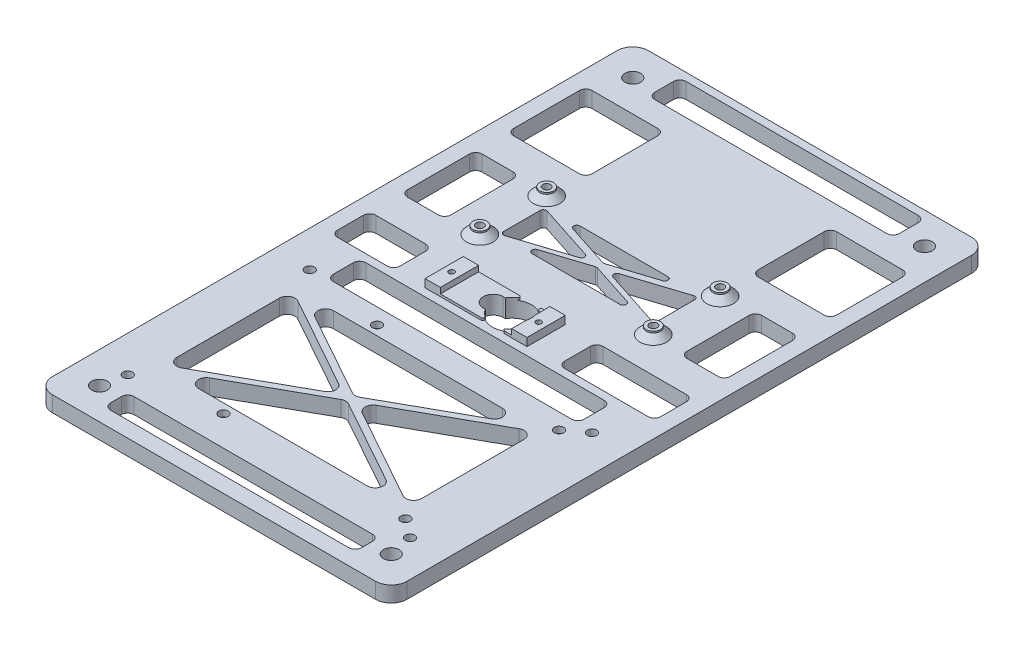
from build123d import *

# Parameters (mm, degrees)
SKETCH1_R           = 2.5000000000000027
BOSS_EXTRUDE1_DEPTH = 5
FILLET1_R           = 5
SKETCH2_R           = 1.5000000000000042
SKETCH2_R_2         = 1.5000000000000009
CUT_EXTRUDE1_DEPTH  = 10
SKETCH3_R           = 1.4999999999999967
SKETCH3_R_2         = 1.4999999999999973
CUT_EXTRUDE2_DEPTH  = 10
CUT_EXTRUDE4_DEPTH  = 10
BOSS_EXTRUDE2_DEPTH = 0.75
CUT_EXTRUDE10_REACH = 112.681
BOSS_EXTRUDE3_START = 2.55
SKETCH14_R          = 0.8750000000000001
SKETCH14_R_2        = 0.8750000000000018
BOSS_EXTRUDE3_DEPTH = 2.55
FILLET2_R           = 0.5
CUT_EXTRUDE9_DEPTH  = 111.64470163546024
CUT_EXTRUDE11_REACH = 112.645
SKETCH15_W          = 19.87499999999999
SKETCH15_H          = 12.200000000000001
SKETCH15_W_2        = 30.625000000000018
FILLET3_R           = 2
CUT_EXTRUDE12_REACH = 112.789
SKETCH16_R          = 1.2500000000000013
CUT_EXTRUDE13_REACH = 112.645
CUT_EXTRUDE14_DEPTH = 111.64470163546024
SKETCH19_R          = 2.2500000000000027
SKETCH19_R_2        = 1.2500000000000013
SKETCH19_R_3        = 2.2500000000000018
BOSS_EXTRUDE4_DEPTH = 2.5
CHAMFER1_SIZE       = 2
SKETCH20_R          = 2.499999999999999
SKETCH20_R_2        = 2.4999999999999982
SKETCH20_R_3        = 2.5000000000000027
CUT_EXTRUDE15_DEPTH = 3


with BuildPart() as part:
    # Sketch1 → Boss-Extrude1 (new body)
    with BuildSketch(Plane(origin=(0, 0, 0), x_dir=(1, 0, 0), z_dir=(0, 1, 0))):
        Polygon((-56.499999999999986, -94.99999999999974), (-56.499999999999986, 95.00000000000009), (56.500000000000014, 94.99999999999997), (56.500000000000014, -94.99999999999986), align=None)
        with Locations((46.500000000000014, 85.00000000000007)):
            Circle(SKETCH1_R, mode=Mode.SUBTRACT)
        with Locations((-46.499999999999986, 85.00000000000007)):
            Circle(SKETCH1_R, mode=Mode.SUBTRACT)
        with Locations((-46.499999999999986, -84.99999999999986)):
            Circle(SKETCH1_R, mode=Mode.SUBTRACT)
        with Locations((46.500000000000014, -84.99999999999986)):
            Circle(SKETCH1_R, mode=Mode.SUBTRACT)
    extrude(amount=BOSS_EXTRUDE1_DEPTH)

    # Fillet1
    fillet1_edges = [part.edges().sort_by_distance(p)[0] for p in [
        (-56.499999999999986, 2.5, 94.99999999999974),
        (-56.499999999999986, 2.5, -95.00000000000009),
        (56.500000000000014, 2.5, -94.99999999999997),
        (56.500000000000014, 2.5, 94.99999999999986),
    ]]
    fillet(fillet1_edges, radius=FILLET1_R)

    # Sketch2 → Cut-Extrude1 (cut)
    with BuildSketch(Plane(origin=(0, 5, 0), x_dir=(1, 0, 0), z_dir=(0, 1, 0))):
        with Locations((38.999999999999886, -23.999999999999687)):
            Circle(SKETCH2_R)
        with Locations((38.999999999999886, -72.99999999999973)):
            Circle(SKETCH2_R)
        with Locations((-19.000000000000114, -23.9999999999998)):
            Circle(SKETCH2_R_2)
        with Locations((-19.000000000000114, -72.99999999999973)):
            Circle(SKETCH2_R_2)
    extrude(amount=-CUT_EXTRUDE1_DEPTH, mode=Mode.SUBTRACT)

    # Sketch3 → Cut-Extrude2 (cut)
    with BuildSketch(Plane(origin=(0, 5, 0), x_dir=(1, 0, 0), z_dir=(0, 1, 0))):
        with Locations((45.00000000000002, -19.49999999999963)):
            Circle(SKETCH3_R)
        with Locations((45.00000000000002, -77.49999999999979)):
            Circle(SKETCH3_R_2)
        with Locations((-44.999999999999964, -19.49999999999963)):
            Circle(SKETCH3_R)
        with Locations((-44.999999999999964, -77.49999999999979)):
            Circle(SKETCH3_R_2)
    extrude(amount=-CUT_EXTRUDE2_DEPTH, mode=Mode.SUBTRACT)

    # Sketch5 → Cut-Extrude4 (cut)
    with BuildSketch(Plane(origin=(0, 5, 0), x_dir=(1, 0, 0), z_dir=(0, 1, 0))):
        with BuildLine():
            Line((-37.99999999999997, -89.99999999999986), (38.00000000000003, -89.99999999999986))
            ThreePointArc((38.00000000000003, -89.99999999999986), (39.41421356237312, -89.41421356237295), (40.00000000000003, -87.99999999999986))
            Line((40.00000000000003, -87.99999999999986), (40.00000000000003, -84.49999999999991))
            ThreePointArc((40.00000000000003, -84.49999999999991), (39.414213562373135, -83.08578643762681), (38.00000000000003, -82.4999999999999))
            Line((38.00000000000003, -82.4999999999999), (-37.99999999999997, -82.4999999999999))
            ThreePointArc((-37.99999999999997, -82.4999999999999), (-39.414213562373064, -83.08578643762682), (-39.99999999999997, -84.49999999999991))
            Line((-39.99999999999997, -84.49999999999991), (-39.99999999999997, -87.99999999999986))
            ThreePointArc((-39.99999999999997, -87.99999999999986), (-39.414213562373064, -89.41421356237295), (-37.99999999999997, -89.99999999999986))
        make_face()
    extrude(amount=-CUT_EXTRUDE4_DEPTH, mode=Mode.SUBTRACT)

    # Sketch6 → Boss-Extrude2 (add)
    with BuildSketch(Plane(origin=(0, 5, 0), x_dir=(1, 0, 0), z_dir=(0, 1, 0))):
        Polygon((6, -6.099999999999998), (-16.75, -6.1000000000000005), (-16.75, 6.1), (6, 6.100000000000001), align=None)
    extrude(amount=BOSS_EXTRUDE2_DEPTH)

    # Sketch13 → Cut-Extrude10 (cut, up to next)
    with BuildSketch(Plane(origin=(0, 5.75, 0), x_dir=(1, 0, 0), z_dir=(0, 1, 0)), mode=Mode.PRIVATE) as cut_extrude10_sk1:
        with BuildLine():
            Line((-5.975000000000009, 3.1750000000000003), (-5.325352101035195, 3.1750000000000087))
            ThreePointArc((-5.325352101035195, 3.1750000000000087), (6.200000000000003, -5.51e-15), (-5.325352101035201, -3.1750000000000003))
            Line((-5.325352101035201, -3.1750000000000003), (-5.974999999999967, -3.1750000000000003))
            ThreePointArc((-5.974999999999967, -3.1750000000000003), (-9.15, -2.076e-14), (-5.975000000000009, 3.1750000000000003))
        make_face()
    cut_extrude10_tool1 = extrude(cut_extrude10_sk1.sketch, amount=-CUT_EXTRUDE10_REACH, mode=Mode.PRIVATE) & part.part
    add(cut_extrude10_tool1.solids().sort_by_distance((-0.860955, 5.75, 0))[0], mode=Mode.SUBTRACT)

    # Sketch14 → Boss-Extrude3 (add)
    # profile 1 of 2: a face of its own
    with BuildSketch(Plane(origin=(0, 5, 0), x_dir=(1, 0, 0), z_dir=(0, 1, 0)).offset(BOSS_EXTRUDE3_START)):
        with BuildLine():
            Line((6, 6.100000000000001), (10.875000000000002, 6.100000000000001))
            Line((10.875000000000002, 6.100000000000001), (10.875000000000005, -6.100000000000001))
            Line((10.875000000000005, -6.100000000000001), (6.000000000000002, -6.100000000000001))
            Line((6.000000000000002, -6.100000000000001), (6, -1.5620499351813408))
            ThreePointArc((6, -1.5620499351813408), (6.200000000000003, 0), (6, 1.5620499351813406))
            Line((6, 1.5620499351813406), (6, 6.100000000000001))
        make_face()
        with Locations((8.5, 0)):
            Circle(SKETCH14_R, mode=Mode.SUBTRACT)
    # profile 2 of 2: a face of its own
    with BuildSketch(Plane(origin=(0, 5, 0), x_dir=(1, 0, 0), z_dir=(0, 1, 0)).offset(BOSS_EXTRUDE3_START)):
        Polygon((-16.75, 6.1), (-21.625000000000004, 6.1), (-21.625000000000004, -6.1000000000000005), (-16.75, -6.1), align=None)
        with Locations((-19.25, 0)):
            Circle(SKETCH14_R_2, mode=Mode.SUBTRACT)
    extrude(amount=-BOSS_EXTRUDE3_DEPTH)

    # Fillet2
    fillet2_edges = [part.edges().sort_by_distance(p)[0] for p in [
        (-1.109053650640968, 5.375, 6.099999999999999),
        (1.1090536506409496, 5.375, -6.1000000000000005),
        (1.1090536506409703, 5.375, 6.099999999999999),
        (6, 6.65, 1.562049935181341),
        (6, 6.65, -1.5620499351813408),
        (-1.10905365064095, 5.375, -6.1000000000000005),
    ]]
    fillet(fillet2_edges, radius=FILLET2_R)

    # Sketch12 → Cut-Extrude9 (cut, through all)
    with BuildSketch(Plane(origin=(0, 5, 0), x_dir=(1, 0, 0), z_dir=(0, 1, 0))):
        Polygon((-51.49999999999999, 75.00000000000001), (-26.49999999999999, 75.00000000000001), (-26.499999999999986, 50), (-51.49999999999999, 50), align=None)
        Polygon((26.499999999999968, 75.00000000000001), (26.49999999999997, 50.00000000000001), (51.49999999999998, 50.000000000000014), (51.49999999999998, 75.00000000000003), align=None)
    extrude(amount=-CUT_EXTRUDE9_DEPTH, mode=Mode.SUBTRACT)

    # Sketch15 → Cut-Extrude11 (cut, up to next)
    with BuildSketch(Plane(origin=(0, 5, 0), x_dir=(1, 0, 0), z_dir=(0, 1, 0)), mode=Mode.PRIVATE) as cut_extrude11_sk1:
        with Locations((-41.5625, 0)):
            Rectangle(SKETCH15_W, SKETCH15_H)
    cut_extrude11_tool1 = extrude(cut_extrude11_sk1.sketch, amount=-CUT_EXTRUDE11_REACH, mode=Mode.PRIVATE) & part.part
    # Sketch15 → Cut-Extrude11 (cut, up to next)
    with BuildSketch(Plane(origin=(0, 5, 0), x_dir=(1, 0, 0), z_dir=(0, 1, 0)), mode=Mode.PRIVATE) as cut_extrude11_sk2:
        with Locations((36.187500000000014, 0)):
            Rectangle(SKETCH15_W_2, SKETCH15_H)
    cut_extrude11_tool2 = extrude(cut_extrude11_sk2.sketch, amount=-CUT_EXTRUDE11_REACH, mode=Mode.PRIVATE) & part.part
    add(cut_extrude11_tool1.solids().sort_by_distance((-41.5625, 5, 0))[0], mode=Mode.SUBTRACT)
    add(cut_extrude11_tool2.solids().sort_by_distance((36.1875, 5, 0))[0], mode=Mode.SUBTRACT)

    # Fillet3
    fillet3_edges = [part.edges().sort_by_distance(p)[0] for p in [
        (-51.49999999999999, 2.5, 6.1000000000000005),
        (-51.49999999999999, 2.5, -6.1000000000000005),
        (-31.625, 2.5, -6.1000000000000005),
        (-31.625, 2.5, 6.1000000000000005),
        (51.50000000000002, 2.5, -6.1000000000000005),
        (20.875000000000004, 2.5, -6.1000000000000005),
        (20.875000000000004, 2.5, 6.1000000000000005),
        (51.50000000000002, 2.5, 6.1000000000000005),
        (51.49999999999998, 2.5, -50.000000000000014),
        (51.49999999999998, 2.5, -75.00000000000003),
        (26.49999999999997, 2.5, -50.00000000000001),
        (26.499999999999968, 2.5, -75.00000000000001),
        (-26.499999999999986, 2.5, -50),
        (-51.49999999999999, 2.5, -50),
        (-51.49999999999999, 2.5, -75.00000000000001),
        (-26.49999999999999, 2.5, -75.00000000000001),
    ]]
    fillet(fillet3_edges, radius=FILLET3_R)

    # Sketch16 → Cut-Extrude12 (cut, up to next)
    with BuildSketch(Plane.XZ, mode=Mode.PRIVATE) as cut_extrude12_sk1:
        with Locations((-27.650000000000002, -17.400000000000002)):
            Circle(SKETCH16_R)
    cut_extrude12_tool1 = extrude(cut_extrude12_sk1.sketch, amount=-CUT_EXTRUDE12_REACH, mode=Mode.PRIVATE) & part.part
    # Sketch16 → Cut-Extrude12 (cut, up to next)
    with BuildSketch(Plane.XZ, mode=Mode.PRIVATE) as cut_extrude12_sk2:
        with Locations((27.649999999999995, -17.400000000000002)):
            Circle(SKETCH16_R)
    cut_extrude12_tool2 = extrude(cut_extrude12_sk2.sketch, amount=-CUT_EXTRUDE12_REACH, mode=Mode.PRIVATE) & part.part
    # Sketch16 → Cut-Extrude12 (cut, up to next)
    with BuildSketch(Plane.XZ, mode=Mode.PRIVATE) as cut_extrude12_sk3:
        with Locations((27.649999999999995, -38.7)):
            Circle(SKETCH16_R)
    cut_extrude12_tool3 = extrude(cut_extrude12_sk3.sketch, amount=-CUT_EXTRUDE12_REACH, mode=Mode.PRIVATE) & part.part
    # Sketch16 → Cut-Extrude12 (cut, up to next)
    with BuildSketch(Plane.XZ, mode=Mode.PRIVATE) as cut_extrude12_sk4:
        with Locations((-27.650000000000002, -38.7)):
            Circle(SKETCH16_R)
    cut_extrude12_tool4 = extrude(cut_extrude12_sk4.sketch, amount=-CUT_EXTRUDE12_REACH, mode=Mode.PRIVATE) & part.part
    # Sketch16 → Cut-Extrude12 (cut, up to next)
    with BuildSketch(Plane.XZ, mode=Mode.PRIVATE) as cut_extrude12_sk5:
        with BuildLine():
            Line((-41.99999999999996, 64.82286479972639), (-41.99999999999996, 32.17713520027302))
            ThreePointArc((-41.99999999999996, 32.17713520027302), (-40.766661957997506, 30.021777345029054), (-38.2835460126705, 29.99304735938606))
            Line((-38.2835460126705, 29.99304735938606), (-8.976584213161308, 46.31591215911274))
            ThreePointArc((-8.976584213161308, 46.31591215911274), (-7.693038200490758, 48.49999999999971), (-8.976584213161308, 50.684087840886676))
            Line((-8.976584213161308, 50.684087840886676), (-38.2835460126705, 67.00695264061336))
            ThreePointArc((-38.2835460126705, 67.00695264061336), (-40.766661957997506, 66.97822265497035), (-41.99999999999996, 64.82286479972639))
        make_face()
    cut_extrude12_tool5 = extrude(cut_extrude12_sk5.sketch, amount=-CUT_EXTRUDE12_REACH, mode=Mode.PRIVATE) & part.part
    # Sketch16 → Cut-Extrude12 (cut, up to next)
    with BuildSketch(Plane.XZ, mode=Mode.PRIVATE) as cut_extrude12_sk6:
        with BuildLine():
            Line((-31.137052150475082, 31.684087840886644), (-4.2164539873294835, 46.67783871656272))
            ThreePointArc((-4.2164539873294835, 46.67783871656272), (-3.0000000000000315, 46.99375087567576), (-1.7835460126705789, 46.67783871656272))
            Line((-1.7835460126705789, 46.67783871656272), (25.137052150475, 31.68408784088665))
            ThreePointArc((25.137052150475, 31.68408784088665), (26.340331578443337, 28.871597104644096), (23.92059816314555, 26.99999999999969))
            Line((23.92059816314555, 26.99999999999969), (-29.92059816314563, 26.999999999999684))
            ThreePointArc((-29.92059816314563, 26.999999999999684), (-32.34033157844341, 28.87159710464409), (-31.137052150475082, 31.684087840886644))
        make_face()
    cut_extrude12_tool6 = extrude(cut_extrude12_sk6.sketch, amount=-CUT_EXTRUDE12_REACH, mode=Mode.PRIVATE) & part.part
    # Sketch16 → Cut-Extrude12 (cut, up to next)
    with BuildSketch(Plane.XZ, mode=Mode.PRIVATE) as cut_extrude12_sk7:
        with BuildLine():
            Line((32.283546012670435, 29.993047359386054), (2.9765842131612517, 46.31591215911275))
            ThreePointArc((2.9765842131612517, 46.31591215911275), (1.6930382004907059, 48.49999999999971), (2.9765842131612517, 50.684087840886676))
            Line((2.9765842131612517, 50.684087840886676), (32.283546012670435, 67.00695264061335))
            ThreePointArc((32.283546012670435, 67.00695264061335), (34.76666195799744, 66.97822265497034), (35.9999999999999, 64.82286479972639))
            Line((35.9999999999999, 64.82286479972639), (35.999999999999886, 32.177135200273014))
            ThreePointArc((35.999999999999886, 32.177135200273014), (34.766661957997435, 30.021777345029065), (32.283546012670435, 29.993047359386054))
        make_face()
    cut_extrude12_tool7 = extrude(cut_extrude12_sk7.sketch, amount=-CUT_EXTRUDE12_REACH, mode=Mode.PRIVATE) & part.part
    # Sketch16 → Cut-Extrude12 (cut, up to next)
    with BuildSketch(Plane.XZ, mode=Mode.PRIVATE) as cut_extrude12_sk8:
        with BuildLine():
            Line((-1.783546012670578, 50.32216128343669), (25.137052150475004, 65.31591215911276))
            ThreePointArc((25.137052150475004, 65.31591215911276), (26.34033157844334, 68.12840289535532), (23.92059816314555, 69.99999999999973))
            Line((23.92059816314555, 69.99999999999973), (-29.92059816314562, 69.99999999999973))
            ThreePointArc((-29.92059816314562, 69.99999999999973), (-32.3403315784434, 68.12840289535534), (-31.13705215047507, 65.31591215911277))
            Line((-31.13705215047507, 65.31591215911277), (-4.216453987329482, 50.32216128343671))
            ThreePointArc((-4.216453987329482, 50.32216128343671), (-3.0000000000000338, 50.00624912432366), (-1.783546012670578, 50.32216128343669))
        make_face()
    cut_extrude12_tool8 = extrude(cut_extrude12_sk8.sketch, amount=-CUT_EXTRUDE12_REACH, mode=Mode.PRIVATE) & part.part
    # Sketch16 → Cut-Extrude12 (cut, up to next)
    with BuildSketch(Plane.XZ, mode=Mode.PRIVATE) as cut_extrude12_sk9:
        with BuildLine():
            Line((-36.999999999999986, -82.50000000000001), (37.00000000000002, -82.50000000000001))
            ThreePointArc((37.00000000000002, -82.50000000000001), (38.414213562373114, -83.08578643762692), (39.000000000000014, -84.50000000000001))
            Line((39.000000000000014, -84.50000000000001), (39.000000000000014, -90.49999999999987))
            ThreePointArc((39.000000000000014, -90.49999999999987), (38.414213562373114, -91.91421356237298), (37.00000000000001, -92.49999999999989))
            Line((37.00000000000001, -92.49999999999989), (-36.99999999999999, -92.49999999999989))
            ThreePointArc((-36.99999999999999, -92.49999999999989), (-38.414213562373085, -91.91421356237296), (-38.999999999999986, -90.49999999999987))
            Line((-38.999999999999986, -90.49999999999987), (-38.999999999999986, -84.50000000000001))
            ThreePointArc((-38.999999999999986, -84.50000000000001), (-38.41421356237308, -83.08578643762692), (-36.999999999999986, -82.50000000000001))
        make_face()
    cut_extrude12_tool9 = extrude(cut_extrude12_sk9.sketch, amount=-CUT_EXTRUDE12_REACH, mode=Mode.PRIVATE) & part.part
    add(cut_extrude12_tool1.solids().sort_by_distance((-27.65, 0, -17.4))[0], mode=Mode.SUBTRACT)
    add(cut_extrude12_tool2.solids().sort_by_distance((27.65, 0, -17.4))[0], mode=Mode.SUBTRACT)
    add(cut_extrude12_tool3.solids().sort_by_distance((27.65, 0, -38.7))[0], mode=Mode.SUBTRACT)
    add(cut_extrude12_tool4.solids().sort_by_distance((-27.65, 0, -38.7))[0], mode=Mode.SUBTRACT)
    add(cut_extrude12_tool5.solids().sort_by_distance((-29.697812, 0, 48.5))[0], mode=Mode.SUBTRACT)
    add(cut_extrude12_tool6.solids().sort_by_distance((-3, 0, 34.022847))[0], mode=Mode.SUBTRACT)
    add(cut_extrude12_tool7.solids().sort_by_distance((23.697812, 0, 48.5))[0], mode=Mode.SUBTRACT)
    add(cut_extrude12_tool8.solids().sort_by_distance((-3, 0, 62.977153))[0], mode=Mode.SUBTRACT)
    add(cut_extrude12_tool9.solids().sort_by_distance((0, 0, -87.5))[0], mode=Mode.SUBTRACT)

    # Sketch17 → Cut-Extrude13 (cut, up to next)
    with BuildSketch(Plane(origin=(0, 5, 0), x_dir=(1, 0, 0), z_dir=(0, 1, 0)), mode=Mode.PRIVATE) as cut_extrude13_sk1:
        with BuildLine():
            Line((-39.65000000000002, 39.95), (-49.49999999999997, 39.95))
            ThreePointArc((-49.49999999999997, 39.95), (-50.91421356237308, 39.364213562373095), (-51.49999999999999, 37.94999999999999))
            Line((-51.49999999999999, 37.94999999999999), (-51.49999999999999, 18.150000000000013))
            ThreePointArc((-51.49999999999999, 18.150000000000013), (-50.914213562373085, 16.7357864376269), (-49.49999999999997, 16.15))
            Line((-49.49999999999997, 16.15), (-39.65000000000002, 16.150000000000002))
            ThreePointArc((-39.65000000000002, 16.150000000000002), (-38.23578643762691, 16.735786437626906), (-37.650000000000006, 18.150000000000016))
            Line((-37.650000000000006, 18.150000000000016), (-37.650000000000006, 37.94999999999999))
            ThreePointArc((-37.650000000000006, 37.94999999999999), (-38.23578643762691, 39.364213562373095), (-39.65000000000002, 39.95))
        make_face()
    cut_extrude13_tool1 = extrude(cut_extrude13_sk1.sketch, amount=-CUT_EXTRUDE13_REACH, mode=Mode.PRIVATE) & part.part
    # Sketch17 → Cut-Extrude13 (cut, up to next)
    with BuildSketch(Plane(origin=(0, 5, 0), x_dir=(1, 0, 0), z_dir=(0, 1, 0)), mode=Mode.PRIVATE) as cut_extrude13_sk2:
        with BuildLine():
            Line((39.65000000000002, 16.150000000000002), (49.49999999999997, 16.15))
            ThreePointArc((49.49999999999997, 16.15), (50.914213562373085, 16.7357864376269), (51.49999999999999, 18.150000000000013))
            Line((51.49999999999999, 18.150000000000013), (51.49999999999999, 37.94999999999999))
            ThreePointArc((51.49999999999999, 37.94999999999999), (50.91421356237308, 39.364213562373095), (49.49999999999997, 39.95))
            Line((49.49999999999997, 39.95), (39.65000000000002, 39.95))
            ThreePointArc((39.65000000000002, 39.95), (38.23578643762691, 39.364213562373095), (37.650000000000006, 37.94999999999999))
            Line((37.650000000000006, 37.94999999999999), (37.650000000000006, 18.150000000000016))
            ThreePointArc((37.650000000000006, 18.150000000000016), (38.23578643762691, 16.735786437626906), (39.65000000000002, 16.150000000000002))
        make_face()
    cut_extrude13_tool2 = extrude(cut_extrude13_sk2.sketch, amount=-CUT_EXTRUDE13_REACH, mode=Mode.PRIVATE) & part.part
    add(cut_extrude13_tool1.solids().sort_by_distance((-44.575, 5, -28.05))[0], mode=Mode.SUBTRACT)
    add(cut_extrude13_tool2.solids().sort_by_distance((44.575, 5, -28.05))[0], mode=Mode.SUBTRACT)

    # Sketch18 → Cut-Extrude14 (cut, through all)
    with BuildSketch(Plane(origin=(0, 5, 0), x_dir=(1, 0, 0), z_dir=(0, 1, 0))):
        with BuildLine():
            Line((-24.65, 33.61152541019357), (-24.65, 21.962876817106313))
            ThreePointArc((-24.65, 21.962876817106313), (-24.238101420184442, 21.154089626569114), (-23.34172656084591, 21.01157902634249))
            Line((-23.34172656084591, 21.01157902634249), (-5.368504958628461, 26.835903322886118))
            ThreePointArc((-5.368504958628461, 26.835903322886118), (-4.676778397782504, 27.787201113649946), (-5.368504958628462, 28.73849890441377))
            Line((-5.368504958628462, 28.73849890441377), (-23.341726560845913, 34.562823200957396))
            ThreePointArc((-23.341726560845913, 34.562823200957396), (-24.238101420184446, 34.42031260073077), (-24.65, 33.61152541019357))
        make_face()
        with BuildLine():
            Line((-14.033418903848766, 35.7), (14.033418903848764, 35.7))
            ThreePointArc((14.033418903848764, 35.7), (15.02116831305243, 34.85604840472781), (14.34169234300285, 33.74870220923614))
            Line((14.34169234300285, 33.74870220923614), (0.3082734391540837, 29.20109330003664))
            ThreePointArc((0.3082734391540837, 29.20109330003664), (4.6e-16, 29.152391090800453), (-0.3082734391540828, 29.20109330003664))
            Line((-0.3082734391540828, 29.20109330003664), (-14.341692343002851, 33.74870220923614))
            ThreePointArc((-14.341692343002851, 33.74870220923614), (-15.021168313052433, 34.85604840472781), (-14.033418903848766, 35.7))
        make_face()
        with BuildLine():
            Line((23.34172656084591, 21.01157902634247), (5.368504958628466, 26.835903322886114))
            ThreePointArc((5.368504958628466, 26.835903322886114), (4.6767783977825115, 27.787201113649942), (5.368504958628469, 28.738498904413767))
            Line((5.368504958628469, 28.738498904413767), (23.341726560845924, 34.562823200957375))
            ThreePointArc((23.341726560845924, 34.562823200957375), (24.238101420184456, 34.42031260073075), (24.650000000000013, 33.61152541019355))
            Line((24.650000000000013, 33.61152541019355), (24.65, 21.96287681710629))
            ThreePointArc((24.65, 21.96287681710629), (24.238101420184442, 21.154089626569093), (23.34172656084591, 21.01157902634247))
        make_face()
        with BuildLine():
            Line((14.34169234300285, 22.351297790763866), (0.30827343915408334, 26.898906699963373))
            ThreePointArc((0.30827343915408334, 26.898906699963373), (1e-16, 26.94760890919956), (-0.3082734391540831, 26.898906699963373))
            Line((-0.3082734391540831, 26.898906699963373), (-14.341692343002851, 22.351297790763873))
            ThreePointArc((-14.341692343002851, 22.351297790763873), (-15.021168313052438, 21.24395159527221), (-14.03341890384877, 20.400000000000013))
            Line((-14.03341890384877, 20.400000000000013), (14.03341890384876, 20.400000000000006))
            ThreePointArc((14.03341890384876, 20.400000000000006), (15.021168313052428, 21.2439515952722), (14.34169234300285, 22.351297790763866))
        make_face()
        with BuildLine():
            Line((-37.99999999999995, -8.6), (38.00000000000001, -8.6))
            ThreePointArc((38.00000000000001, -8.6), (39.414213562373114, -9.185786437626906), (40.00000000000002, -10.600000000000014))
            Line((40.00000000000002, -10.600000000000014), (40.00000000000002, -16.999999999999673))
            ThreePointArc((40.00000000000002, -16.999999999999673), (39.414213562373114, -18.414213562372783), (38.00000000000001, -18.999999999999687))
            Line((38.00000000000001, -18.999999999999687), (-37.99999999999995, -18.999999999999687))
            ThreePointArc((-37.99999999999995, -18.999999999999687), (-39.41421356237306, -18.414213562372783), (-39.999999999999964, -16.999999999999673))
            Line((-39.999999999999964, -16.999999999999673), (-39.999999999999964, -10.600000000000014))
            ThreePointArc((-39.999999999999964, -10.600000000000014), (-39.41421356237306, -9.185786437626904), (-37.99999999999995, -8.6))
        make_face()
    extrude(amount=-CUT_EXTRUDE14_DEPTH, mode=Mode.SUBTRACT)

    # Sketch19 → Boss-Extrude4 (add)
    # profile 1 of 4: a face of its own
    with BuildSketch(Plane(origin=(0, 5, 0), x_dir=(1, 0, 0), z_dir=(0, 1, 0))):
        with Locations((-27.650000000000002, 38.7)):
            Circle(SKETCH19_R)
        with Locations((-27.650000000000002, 38.7)):
            Circle(SKETCH19_R_2, mode=Mode.SUBTRACT)
    # profile 2 of 4: a face of its own
    with BuildSketch(Plane(origin=(0, 5, 0), x_dir=(1, 0, 0), z_dir=(0, 1, 0))):
        with Locations((-27.650000000000002, 17.400000000000002)):
            Circle(SKETCH19_R_3)
        with Locations((-27.650000000000002, 17.400000000000002)):
            Circle(SKETCH19_R_2, mode=Mode.SUBTRACT)
    # profile 3 of 4: a face of its own
    with BuildSketch(Plane(origin=(0, 5, 0), x_dir=(1, 0, 0), z_dir=(0, 1, 0))):
        with Locations((27.649999999999995, 38.7)):
            Circle(SKETCH19_R_3)
        with Locations((27.649999999999995, 38.7)):
            Circle(SKETCH19_R_2, mode=Mode.SUBTRACT)
    # profile 4 of 4: a face of its own
    with BuildSketch(Plane(origin=(0, 5, 0), x_dir=(1, 0, 0), z_dir=(0, 1, 0))):
        with Locations((27.649999999999995, 17.400000000000002)):
            Circle(SKETCH19_R_3)
        with Locations((27.649999999999995, 17.400000000000002)):
            Circle(SKETCH19_R_2, mode=Mode.SUBTRACT)
    extrude(amount=BOSS_EXTRUDE4_DEPTH)

    # Chamfer1
    chamfer1_edges = [part.edges().sort_by_distance(p)[0] for p in [
        (-29.900000000000006, 5, -38.7),
        (-29.900000000000006, 5, -17.400000000000002),
        (25.39999999999999, 5, -17.400000000000002),
        (25.39999999999999, 5, -38.7),
    ]]
    chamfer(chamfer1_edges, length=CHAMFER1_SIZE)

    # Sketch20 → Cut-Extrude15 (cut)
    with BuildSketch(Plane.XZ):
        with Locations((-19.000000000000114, 72.99999999999973)):
            Circle(SKETCH20_R)
        with Locations((-19.000000000000114, 23.9999999999998)):
            Circle(SKETCH20_R_2)
        with Locations((38.999999999999886, 23.999999999999687)):
            Circle(SKETCH20_R_3)
        with Locations((38.999999999999886, 72.99999999999973)):
            Circle(SKETCH20_R_3)
    extrude(amount=-CUT_EXTRUDE15_DEPTH, mode=Mode.SUBTRACT)


solid = part.part
